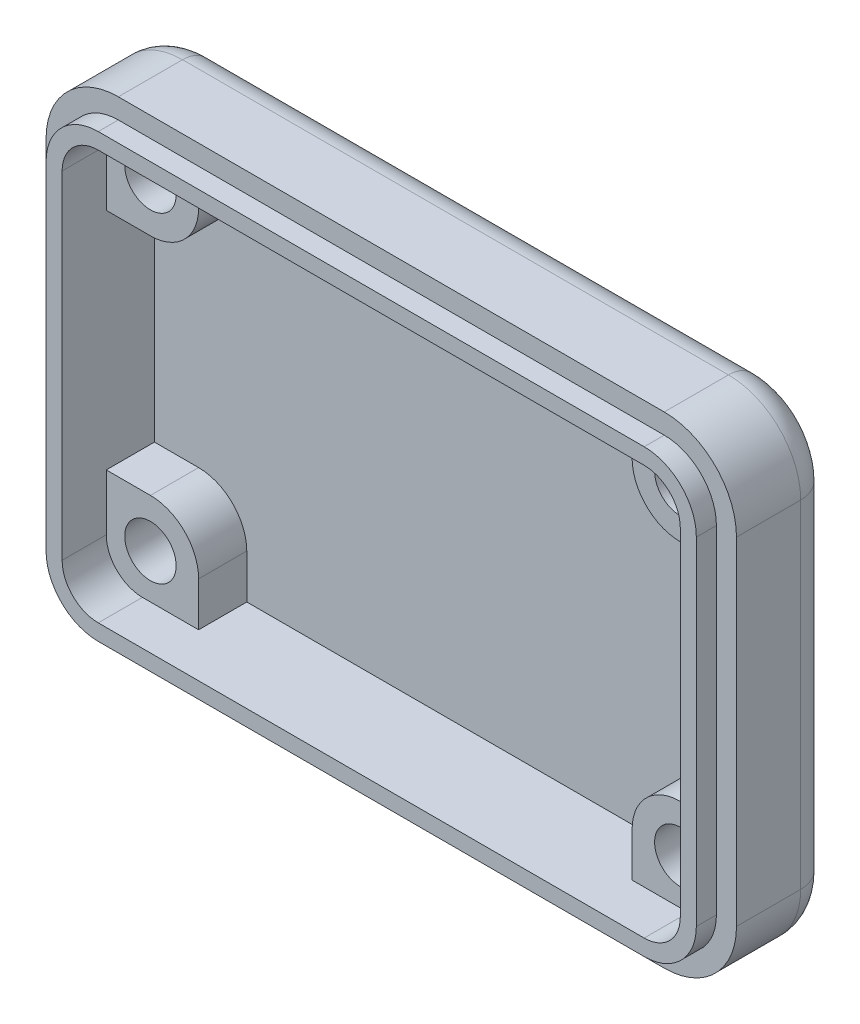
from build123d import *

# Parameters (mm, degrees)
EXTRUDE_1_DEPTH     = 6
CUT_EXTRUDE_1_DEPTH = 4.5
EXTRUDE_4_DEPTH     = 3
SKETCH_4_R          = 1.6
CUT_EXTRUDE_2_DEPTH = 6
EXTRUDE_START       = 1.25
EXTRUDE_5_DEPTH     = 1.25
SKETCH_6_R          = 3
CUT_EXTRUDE_3_DEPTH = 1
FILLET_1_R          = 2


with BuildPart() as part:
    # Эскиз1 → Бобышка-Вытянуть1 (new body)
    with BuildSketch(Plane.XY):
        with BuildLine():
            Line((-17, -15), (17, -15))
            ThreePointArc((17, -15), (20.181980515, -13.681980515), (21.5, -10.5))
            Line((21.5, -10.5), (21.5, 10.5))
            ThreePointArc((21.5, 10.5), (20.181980515, 13.681980515), (17, 15))
            Line((17, 15), (-17, 15))
            ThreePointArc((-17, 15), (-20.181980515, 13.681980515), (-21.5, 10.5))
            Line((-21.5, 10.5), (-21.5, -10.5))
            ThreePointArc((-21.5, -10.5), (-20.181980515, -13.681980515), (-17, -15))
        make_face()
    extrude(amount=EXTRUDE_1_DEPTH)

    # Эскиз2 → Вырез-Вытянуть1 (cut)
    with BuildSketch(Plane.XY.offset(6)):
        with BuildLine():
            Line((-17, -12.75), (17, -12.75))
            ThreePointArc((17, -12.75), (18.590990258, -12.090990258), (19.25, -10.5))
            Line((19.25, -10.5), (19.25, 10.5))
            ThreePointArc((19.25, 10.5), (18.590990258, 12.090990258), (17, 12.75))
            Line((17, 12.75), (-17, 12.75))
            ThreePointArc((-17, 12.75), (-18.590990258, 12.090990258), (-19.25, 10.5))
            Line((-19.25, 10.5), (-19.25, -10.5))
            ThreePointArc((-19.25, -10.5), (-18.590990258, -12.090990258), (-17, -12.75))
        make_face()
    extrude(amount=-CUT_EXTRUDE_1_DEPTH, mode=Mode.SUBTRACT)

    # Эскиз3 → Бобышка-Вытянуть4 (add)
    with BuildSketch(Plane.XY.offset(1.5)):
        with BuildLine():
            Line((-13.5, 10), (-13.5, 13))
            Line((-13.5, 13), (-19.5, 13))
            Line((-19.5, 13), (-19.5, 7))
            Line((-19.5, 7), (-16.5, 7))
            ThreePointArc((-16.5, 7), (-14.378679656, 7.878679656), (-13.5, 10))
        make_face()
        with BuildLine():
            Line((-16.5, -7), (-19.5, -7))
            Line((-19.5, -7), (-19.5, -13))
            Line((-19.5, -13), (-13.5, -13))
            Line((-13.5, -13), (-13.5, -10))
            ThreePointArc((-13.5, -10), (-14.378679656, -7.878679656), (-16.5, -7))
        make_face()
        with BuildLine():
            Line((16.5, -7), (19.5, -7))
            Line((19.5, -7), (19.5, -13))
            Line((19.5, -13), (13.5, -13))
            Line((13.5, -13), (13.5, -10))
            ThreePointArc((13.5, -10), (14.378679656, -7.878679656), (16.5, -7))
        make_face()
        with BuildLine():
            Line((13.5, 10), (13.5, 13))
            Line((13.5, 13), (19.5, 13))
            Line((19.5, 13), (19.5, 7))
            Line((19.5, 7), (16.5, 7))
            ThreePointArc((16.5, 7), (14.378679656, 7.878679656), (13.5, 10))
        make_face()
    extrude(amount=EXTRUDE_4_DEPTH)

    # Эскиз4 → Вырез-Вытянуть2 (cut)
    with BuildSketch(Plane.XY.offset(4.5)):
        with Locations((16.5, -10)):
            Circle(SKETCH_4_R)
        with Locations((-16.5, -10)):
            Circle(SKETCH_4_R)
        with Locations((-16.5, 10)):
            Circle(SKETCH_4_R)
        with Locations((16.5, 10)):
            Circle(SKETCH_4_R)
    extrude(amount=-CUT_EXTRUDE_2_DEPTH, mode=Mode.SUBTRACT)

    # Эскиз5 → Бобышка-Вытянуть5 (add)
    with BuildSketch(Plane.XY.offset(6).offset(EXTRUDE_START)):
        with BuildLine():
            Line((17, -13.75), (-17, -13.75))
            ThreePointArc((-17, -13.75), (-19.298097039, -12.798097039), (-20.25, -10.5))
            Line((-20.25, -10.5), (-20.25, 10.5))
            ThreePointArc((-20.25, 10.5), (-19.298097039, 12.798097039), (-17, 13.75))
            Line((-17, 13.75), (17, 13.75))
            ThreePointArc((17, 13.75), (19.298097039, 12.798097039), (20.25, 10.5))
            Line((20.25, 10.5), (20.25, -10.5))
            ThreePointArc((20.25, -10.5), (19.298097039, -12.798097039), (17, -13.75))
        make_face()
        with BuildLine():
            Line((17, -12.75), (-17, -12.75))
            ThreePointArc((-17, -12.75), (-18.590990258, -12.090990258), (-19.25, -10.5))
            Line((-19.25, -10.5), (-19.25, 10.5))
            ThreePointArc((-19.25, 10.5), (-18.590990258, 12.090990258), (-17, 12.75))
            Line((-17, 12.75), (17, 12.75))
            ThreePointArc((17, 12.75), (18.590990258, 12.090990258), (19.25, 10.5))
            Line((19.25, 10.5), (19.25, -10.5))
            ThreePointArc((19.25, -10.5), (18.590990258, -12.090990258), (17, -12.75))
        make_face(mode=Mode.SUBTRACT)
    extrude(amount=-EXTRUDE_5_DEPTH)

    # Эскиз6 → Вырез-Вытянуть3 (cut)
    with BuildSketch(Plane(origin=(0, 0, 0), x_dir=(-1, 0, 0), z_dir=(0, 0, -1))):
        with Locations((16.5, -10)):
            Circle(SKETCH_6_R)
        with Locations((-16.5, -10)):
            Circle(SKETCH_6_R)
        with Locations((16.5, 10)):
            Circle(SKETCH_6_R)
        with Locations((-16.5, 10)):
            Circle(SKETCH_6_R)
    extrude(amount=-CUT_EXTRUDE_3_DEPTH, mode=Mode.SUBTRACT)

    # Скругление1
    fillet_1_edges = [part.edges().sort_by_distance(p)[0] for p in [
        (21.5, 0, 0),
        (20.181980515, -13.681980515, 0),
        (0, -15, 0),
        (-20.181980515, -13.681980515, 0),
        (-21.5, 0, 0),
        (-20.181980515, 13.681980515, 0),
        (0, 15, 0),
        (20.181980515, 13.681980515, 0),
    ]]
    fillet(fillet_1_edges, radius=FILLET_1_R - 0.0001)  # a hair under: the kernel refuses the full size


solid = part.part
